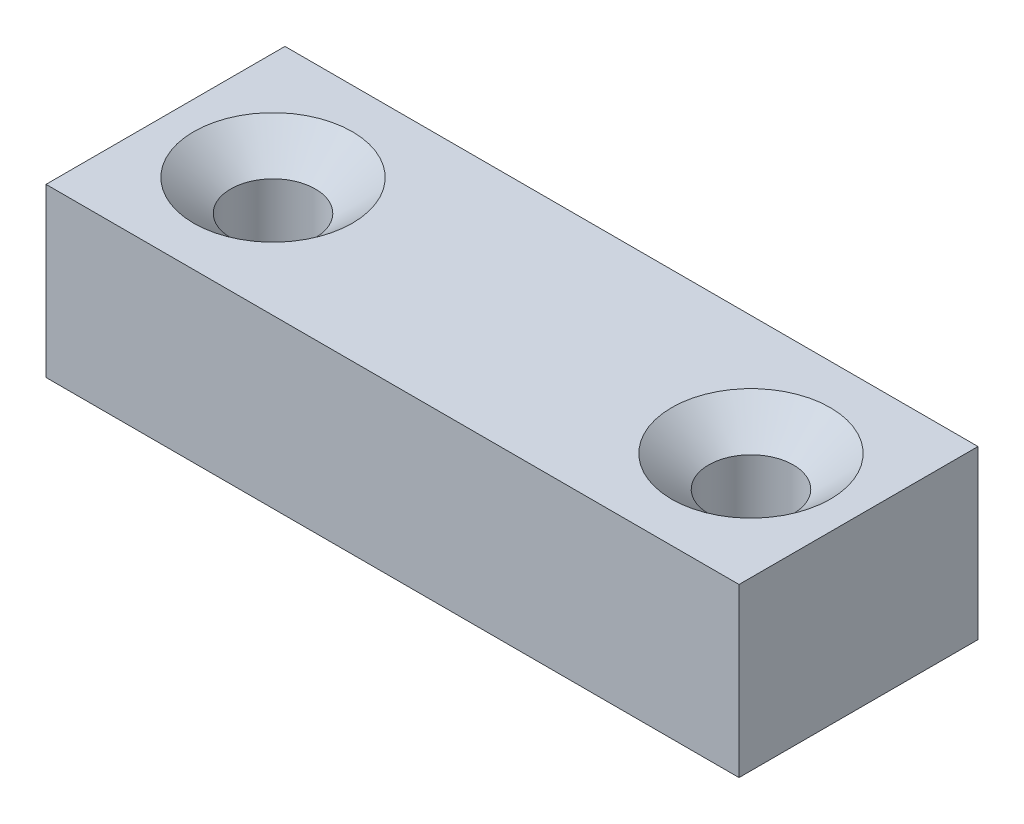
from build123d import *

# Parameters (mm, degrees)
SKETCH1_W                                         = 36.83
SKETCH1_H                                         = 12.7
BOSS_EXTRUDE1_DEPTH                               = 8.89
CSK_FOR_8_FLAT_HEAD_MACHINE_SCREW_100_D           = 4.4958
CSK_FOR_8_FLAT_HEAD_MACHINE_SCREW_100_CSINK_D     = 8.4328
CSK_FOR_8_FLAT_HEAD_MACHINE_SCREW_100_CSINK_ANGLE = 100


with BuildPart() as part:
    # Sketch1 → Boss-Extrude1 (new body)
    with BuildSketch(Plane(origin=(0, 0, 0), x_dir=(1, 0, 0), z_dir=(0, 1, 0))):
        with Locations((18.415, -6.35)):
            Rectangle(SKETCH1_W, SKETCH1_H)
    extrude(amount=BOSS_EXTRUDE1_DEPTH)

    # CSK for #8 Flat Head Machine Screw (100)1 (through all)
    with Locations(Plane(origin=(0, 8.89, 0), x_dir=(1, 0, 0), z_dir=(0, 1, 0))):
        with Locations((5.715, -6.35), (31.115, -6.35)):
            CounterSinkHole(CSK_FOR_8_FLAT_HEAD_MACHINE_SCREW_100_D / 2, CSK_FOR_8_FLAT_HEAD_MACHINE_SCREW_100_CSINK_D / 2, counter_sink_angle=CSK_FOR_8_FLAT_HEAD_MACHINE_SCREW_100_CSINK_ANGLE)


solid = part.part
